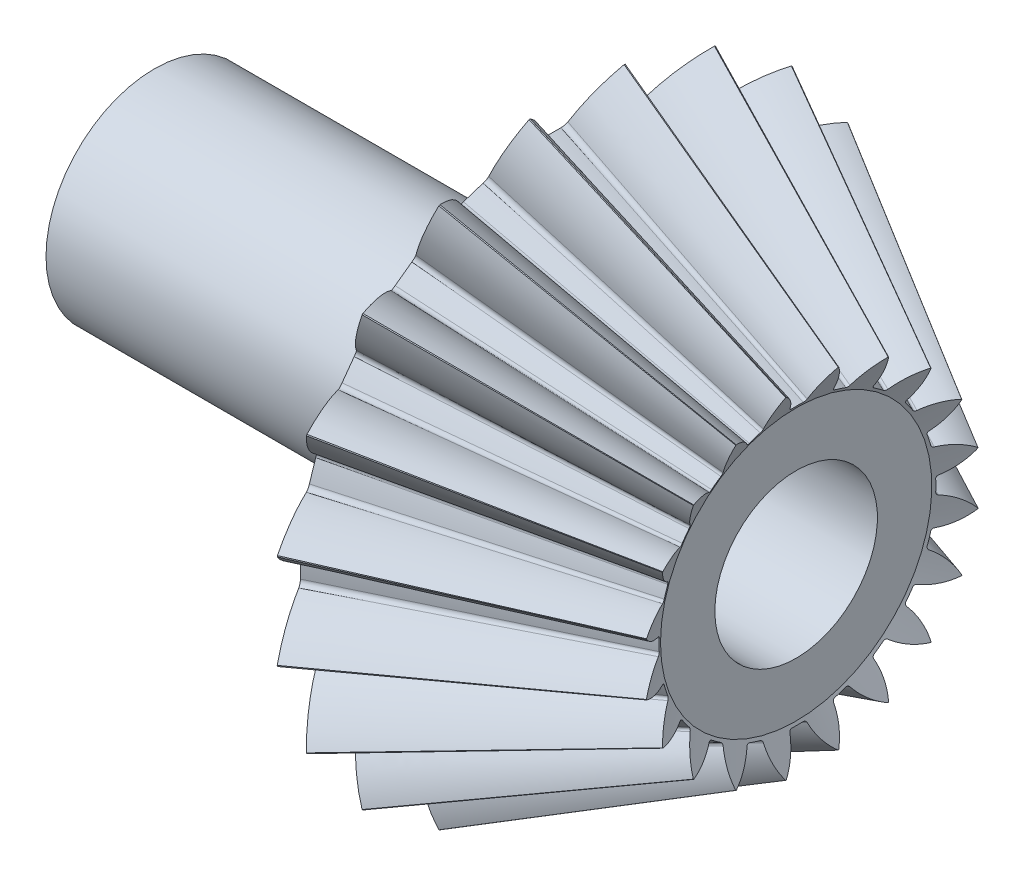
from build123d import *

# Parameters (mm, degrees)
TEETHCUTS_COUNT = 20
TEETHCUTS_ANGLE = 342
HUBSKE_R        = 4
HUB_DEPTH       = 14.528291257
BORSKE_R        = 3
BORE_DEPTH      = 35.0000508


with BuildPart() as part:
    # BasProSke → Base-Revolve (revolve)
    with BuildSketch(Plane(origin=(0, 0, 0), x_dir=(1, 0, 0), z_dir=(0, 1, 0)), mode=Mode.PRIVATE) as base_revolve_sk:
        Polygon((0, 0), (0, 9.056379314), (1.07331263, 11.203004572), (9.748584537, 6.192868611), (9.155271908, 5.006243354), (9.155271908, 0), align=None)
    revolve(base_revolve_sk.sketch.rotate(Axis((-10, 0, 0), (1, 0, 0)), 180), axis=Axis((-10, 0, 0), (1, 0, 0)))

    # ToothCut: read off the stored shape, not the designer's step
    # ToothCut: loft between two sections, ruled curve by curve
    toothcut_from = [
        Edge.make_bspline([(20.475175686, 0.006730684, -0.010230454), (20.472620769, 0.00162085, -0.014432703), (20.469472441, -0.004675805, -0.01357417), (20.467444062, -0.008732563, -0.008122078)], [0, 0, 0, 0, 1, 1, 1, 1], 3, [1, 0.818595861, 0.818595861, 1]),
        Edge.make_bspline([(20.467444062, -0.008732563, 0.008122078), (20.469472441, -0.004675805, 0.01357417), (20.472620769, 0.00162085, 0.014432703), (20.475175686, 0.006730684, 0.010230454)], [0, 0, 0, 0, 1, 1, 1, 1], 3, [1, 0.818595861, 0.818595861, 1]),
        Edge.make_bspline([(20.467444062, -0.008732563, -0.008122078), (20.467124412, -0.009371863, -0.007262889), (20.466857955, -0.009904777, -0.006317325), (20.466649302, -0.010322084, -0.005301744)], [0, 0, 0, 0, 1, 1, 1, 1], 3, [1, 0.994233588, 0.994233588, 1]),
        Edge.make_bspline([(20.466649302, -0.010322084, 0.005301744), (20.466857955, -0.009904777, 0.006317325), (20.467124412, -0.009371863, 0.007262889), (20.467444062, -0.008732563, 0.008122078)], [0, 0, 0, 0, 1, 1, 1, 1], 3, [1, 0.994233588, 0.994233588, 1]),
        Edge.make_bspline([(20.466649302, -0.010322084, -0.005301744), (20.465946663, -0.011727361, -0.001881792), (20.465946663, -0.011727361, 0.001881792), (20.466649302, -0.010322084, 0.005301744)], [0, 0, 0, 0, 1, 1, 1, 1], 3, [1, 0.939130155, 0.939130155, 1]),
        Edge.make_line((20.475175686, 0.006730684, 0.010230454), (20.475175686, 0.006730684, -0.010230454)),
    ]
    toothcut_to = [
        Edge.make_bspline([(1.101068829, 11.258516969, -1.946212593), (0.857940224, 10.77225976, -1.2651625), (0.53110282, 10.118584953, -0.790532769), (0.153974829, 9.364328972, -0.570852964)], [0, 0, 0, 0, 1, 1, 1, 1], 3, [1, 0.965917598, 0.965917598, 1]),
        Edge.make_bspline([(0.153974829, 9.364328972, 0.570852964), (0.53110282, 10.118584953, 0.790532769), (0.857940224, 10.77225976, 1.2651625), (1.101068829, 11.258516969, 1.946212593)], [0, 0, 0, 0, 1, 1, 1, 1], 3, [1, 0.965917598, 0.965917598, 1]),
        Edge.make_bspline([(0.153974829, 9.364328972, -0.570852964), (0.113805435, 9.283990183, -0.547453999), (0.089108685, 9.234596684, -0.472849938), (0.090831971, 9.238043256, -0.380110711)], [0, 0, 0, 0, 1, 1, 1, 1], 3, [1, 0.852242502, 0.852242502, 1]),
        Edge.make_bspline([(0.090831971, 9.238043256, 0.380110711), (0.089108685, 9.234596684, 0.472849938), (0.113805435, 9.283990183, 0.547453999), (0.153974829, 9.364328972, 0.570852964)], [0, 0, 0, 0, 1, 1, 1, 1], 3, [1, 0.852242502, 0.852242502, 1]),
        Edge.make_bspline([(0.090831971, 9.238043256, -0.380110711), (0.095539445, 9.247458203, -0.126776434), (0.095539445, 9.247458203, 0.126776434), (0.090831971, 9.238043256, 0.380110711)], [0, 0, 0, 0, 1, 1, 1, 1], 3, [1, 0.999425256, 0.999425256, 1]),
        Edge.make_line((1.101068829, 11.258516969, 1.946212593), (1.101068829, 11.258516969, -1.946212593)),
    ]
    toothcut = Solid(Shell([*[Face.make_surface_from_curves(toothcut_from[k], toothcut_to[k]) for k in range(6)], Face(Wire(toothcut_from)), Face(Wire(toothcut_to))]))
    add(toothcut, mode=Mode.SUBTRACT)

    # TeethCuts: ToothCut ×20 about axis
    teethcuts_axis = Axis((-10, 0, 0), (1, 0, 0))
    for i in range(1, TEETHCUTS_COUNT):
        add(toothcut.rotate(teethcuts_axis, i * TEETHCUTS_ANGLE / (TEETHCUTS_COUNT - 1)), mode=Mode.SUBTRACT)

    # HubSke → Hub (add)
    with BuildSketch(Plane.ZY):
        with Locations(Location((0, 0, 0), (0, 0, 180))):
            Circle(HUBSKE_R)
    extrude(amount=HUB_DEPTH)

    # BorSke → Bore (cut, symmetric)
    with BuildSketch(Plane(origin=(0, 0, 0), x_dir=(0, 0, -1), z_dir=(1, 0, 0))):
        with Locations(Location((0, 0, 0), (0, 0, 180))):
            Circle(BORSKE_R)
    extrude(amount=BORE_DEPTH, both=True, mode=Mode.SUBTRACT)


solid = part.part
